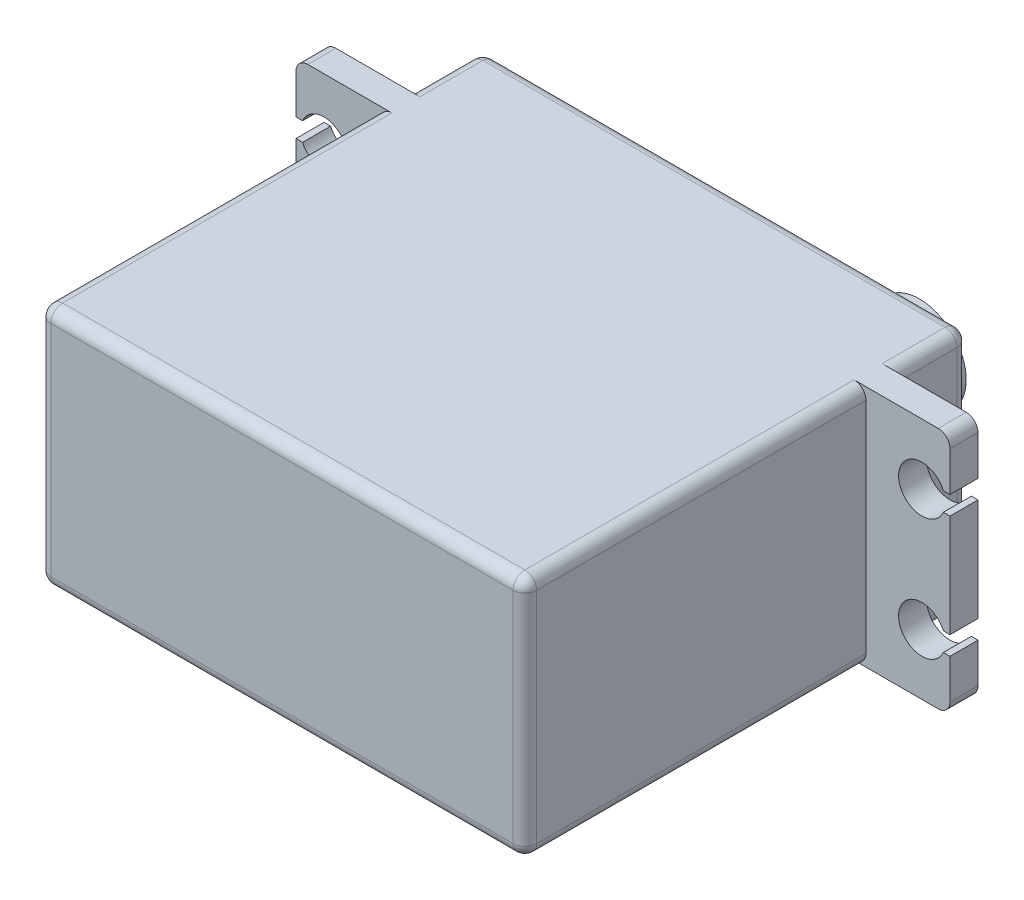
from build123d import *

# Parameters (mm, degrees)
BOSS_EXTRUDE1_DEPTH = 20.6375
CUT_EXTRUDE1_DEPTH  = 62.264183705
FILLET1_R           = 1
FILLET2_R           = 1
SKETCH3_R           = 4.7625
BOSS_EXTRUDE2_DEPTH = 3.175
FILLET3_R           = 1
SKETCH4_R           = 3.96875
BOSS_EXTRUDE3_DEPTH = 3.175


with BuildPart() as part:
    # Sketch1 → Boss-Extrude1 (new body)
    with BuildSketch(Plane(origin=(0, 0, 0), x_dir=(1, 0, 0), z_dir=(0, 1, 0))):
        Polygon((0, 0), (-41.275, 0), (-41.275, 28.971875), (-48.41875, 28.971875), (-48.41875, 31.353125), (-41.275, 31.353125), (-41.275, 37.703125), (0, 37.703125), (0, 31.353125), (7.14375, 31.353125), (7.14375, 28.971875), (0, 28.971875), align=None)
    extrude(amount=BOSS_EXTRUDE1_DEPTH)

    # Sketch2 → Cut-Extrude1 (cut, through all)
    with BuildSketch(Plane(origin=(0, 0, -31.353125), x_dir=(-1, 0, 0), z_dir=(0, 0, -1))):
        with BuildLine():
            Line((-7.14375, 16.271875), (-6.581209729, 16.271875))
            ThreePointArc((-6.581209729, 16.271875), (-2.778125, 15.478125), (-6.581209729, 14.684375))
            Line((-6.581209729, 14.684375), (-7.14375, 14.684375))
            Line((-7.14375, 14.684375), (-7.14375, 16.271875))
        make_face()
        with BuildLine():
            Line((47.856209729, 16.271875), (48.41875, 16.271875))
            Line((48.41875, 16.271875), (48.41875, 14.684375))
            Line((48.41875, 14.684375), (47.856209729, 14.684375))
            ThreePointArc((47.856209729, 14.684375), (44.053125, 15.478125), (47.856209729, 16.271875))
        make_face()
        with BuildLine():
            Line((47.856209729, 4.365625), (48.41875, 4.365625))
            Line((48.41875, 4.365625), (48.41875, 5.953125))
            Line((48.41875, 5.953125), (47.856209729, 5.953125))
            ThreePointArc((47.856209729, 5.953125), (44.053125, 5.159375), (47.856209729, 4.365625))
        make_face()
        with BuildLine():
            Line((-7.14375, 5.953125), (-6.581209729, 5.953125))
            ThreePointArc((-6.581209729, 5.953125), (-2.778125, 5.159375), (-6.581209729, 4.365625))
            Line((-6.581209729, 4.365625), (-7.14375, 4.365625))
            Line((-7.14375, 4.365625), (-7.14375, 5.953125))
        make_face()
    extrude(amount=-CUT_EXTRUDE1_DEPTH, mode=Mode.SUBTRACT)

    # Fillet1
    fillet1_edges = [part.edges().sort_by_distance(p)[0] for p in [
        (-48.41875, 20.6375, -30.1625),
        (-48.41875, 0, -30.1625),
        (7.14375, 0, -30.1625),
        (7.14375, 20.6375, -30.1625),
    ]]
    fillet(fillet1_edges, radius=FILLET1_R)

    # Fillet2
    fillet2_edges = [part.edges().sort_by_distance(p)[0] for p in [
        (-20.6375, 0, -37.703125),
        (-20.6375, 20.6375, -37.703125),
        (-41.275, 10.31875, -37.703125),
        (0, 10.31875, -37.703125),
        (-41.275, 0, -34.528125),
        (-41.275, 20.6375, -34.528125),
        (0, 0, -34.528125),
        (0, 20.6375, -34.528125),
        (0, 0, -14.4859375),
        (0, 20.6375, -14.4859375),
        (0, 10.31875, 0),
        (-20.6375, 20.6375, 0),
        (-20.6375, 0, 0),
        (-41.275, 10.31875, 0),
        (-41.275, 20.6375, -14.4859375),
        (-41.275, 0, -14.4859375),
    ]]
    fillet(fillet2_edges, radius=FILLET2_R)

    # Sketch3 → Boss-Extrude2 (add)
    with BuildSketch(Plane(origin=(0, 0, -37.703125), x_dir=(-1, 0, 0), z_dir=(0, 0, -1))):
        with Locations((10.525, 10.31875)):
            Circle(SKETCH3_R)
    extrude(amount=BOSS_EXTRUDE2_DEPTH)

    # Fillet3
    fillet3_edges = [part.edges().sort_by_distance(p)[0] for p in [
        (-5.7625, 10.31875, -37.703125),
    ]]
    fillet(fillet3_edges, radius=FILLET3_R)

    # Sketch4 → Boss-Extrude3 (add)
    with BuildSketch(Plane(origin=(0, 0, -40.878125), x_dir=(-1, 0, 0), z_dir=(0, 0, -1))):
        with Locations((10.525, 10.31875)):
            Circle(SKETCH4_R)
    extrude(amount=BOSS_EXTRUDE3_DEPTH)


solid = part.part
